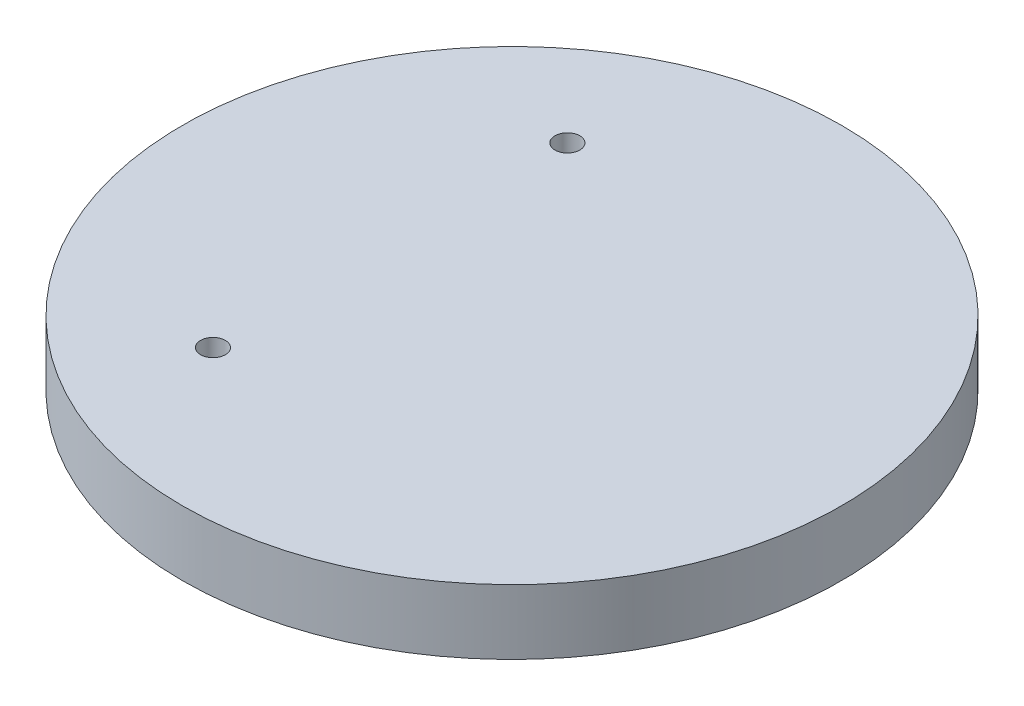
from build123d import *

# Parameters (mm, degrees)
FILLET1_R          = 10
SKETCH6_R          = 1.15
CUT_EXTRUDE1_DEPTH = 10


with BuildPart() as part:
    # Sketch2 → Revolve1 (revolve)
    with BuildSketch(Plane.XY, mode=Mode.PRIVATE) as revolve1_sk:
        Polygon((0, 4), (-3.05, 4), (-3.05, 3), (-3.05, 0), (-5.05, 0), (-5.05, 4), (-28.5, 4), (-28.5, 0), (-30.5, 0), (-30.5, 4), (-30.5, 6), (0, 6), align=None)
    revolve(revolve1_sk.sketch.rotate(Axis((0, 0, 0), (0, 1, 0)), 270), axis=Axis((0, 0, 0), (0, 1, 0)))

    # Fillet1
    # the kernel refuses this fillet: 10 mm, written as the material it adds along each edge
    with BuildSketch(Plane(origin=(0, 4, 0), x_dir=(0, 0, -1), z_dir=(1, 0, 0))) as fillet1_piece_1:
        with BuildLine():
            CenterArc((20.5, -10), FILLET1_R, 36.869897646, 53.130102354)
            Line((28.5, -4), (28.66, -3.88))
            ThreePointArc((28.66, -3.88), (28.7, -2), (28.7, 0))
            Line((28.7, 0), (28.5, 0.2))
            Line((28.5, 0.2), (20.5, 0.2))
            Line((20.5, 0.2), (20.5, 0))
        make_face()
    revolve(axis=Axis((0, 4, 0), (0, 1, 0)))
    with BuildSketch(Plane(origin=(0, 4, 0), x_dir=(0, 0, -1), z_dir=(1, 0, 0))) as fillet1_piece_2:
        with BuildLine():
            CenterArc((13.05, -10), FILLET1_R, 90, 53.130102354)
            Line((13.05, 0), (13.05, 0.2))
            Line((13.05, 0.2), (5.05, 0.2))
            Line((5.05, 0.2), (4.85, 0))
            ThreePointArc((4.85, 0), (4.85, -2), (4.89, -3.88))
            Line((4.89, -3.88), (5.05, -4))
        make_face()
    revolve(axis=Axis((0, 4, 0), (0, 1, 0)))

    # Sketch6 → Cut-Extrude1 (cut)
    with BuildSketch(Plane(origin=(0, 6, 0), x_dir=(1, 0, 0), z_dir=(0, 1, 0))):
        with Locations(Location((-11.275, 16.4, 0), (0, 0, 270))):
            Circle(SKETCH6_R)
        with Locations(Location((-11.275, -16.4, 0), (0, 0, 270))):
            Circle(SKETCH6_R)
    extrude(amount=-CUT_EXTRUDE1_DEPTH, mode=Mode.SUBTRACT)


solid = part.part
